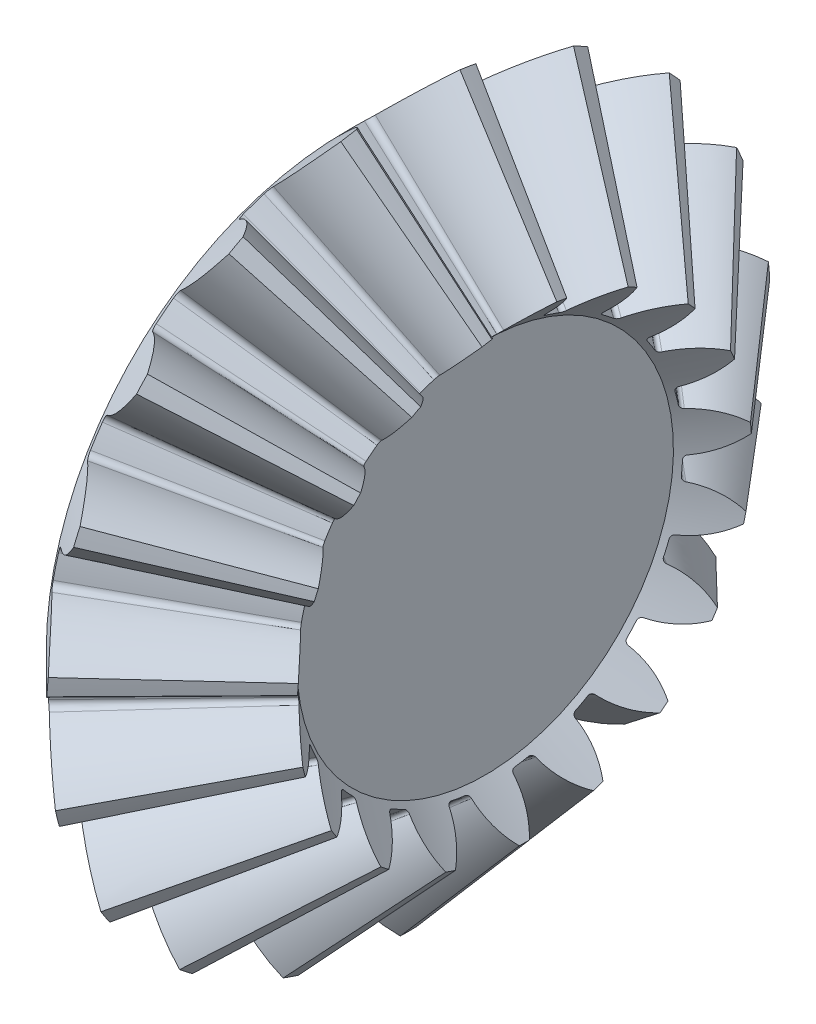
from build123d import *

# Parameters (mm, degrees)
TEETHCUTS_COUNT    = 19
TEETHCUTS_ANGLE    = 341.052631579
CUT_EXTRUDE1_DEPTH = 5.852975702


with BuildPart() as part:
    # BasProSke → Base-Revolve (revolve)
    with BuildSketch(Plane(origin=(0, 0, 0), x_dir=(1, 0, 0), z_dir=(0, 1, 0)), mode=Mode.PRIVATE) as base_revolve_sk:
        Polygon((0, 0), (0, 16.899008978), (3.515204589, 20.414213561), (10.059956604, 12.816829953), (7.852975702, 10.609849055), (7.852975702, 0), align=None)
    revolve(base_revolve_sk.sketch.rotate(Axis((-10, 0, 0), (1, 0, 0)), 180), axis=Axis((-10, 0, 0), (1, 0, 0)))

    # ToothCut: read off the stored shape, not the designer's step
    # ToothCut: loft between two sections, ruled curve by curve
    toothcut_from = [
        Edge.make_bspline([(21.106983915, 0.00599289, -0.009458337), (21.102776765, 0.001785739, -0.014789731), (21.097156118, -0.003834907, -0.013989325), (21.093785022, -0.007206003, -0.007578755)], [0, 0, 0, 0, 1, 1, 1, 1], 3, [1, 0.782762421, 0.782762421, 1]),
        Edge.make_bspline([(21.093785022, -0.007206003, 0.007578755), (21.097156118, -0.003834907, 0.013989325), (21.102776765, 0.001785739, 0.014789731), (21.106983915, 0.00599289, 0.009458337)], [0, 0, 0, 0, 1, 1, 1, 1], 3, [1, 0.782762421, 0.782762421, 1]),
        Edge.make_bspline([(21.093785022, -0.007206003, -0.007578755), (21.093275499, -0.007715527, -0.006609831), (21.092868168, -0.008122857, -0.005548601), (21.092571247, -0.008419779, -0.004416471)], [0, 0, 0, 0, 1, 1, 1, 1], 3, [1, 0.993277042, 0.993277042, 1]),
        Edge.make_bspline([(21.092571247, -0.008419779, 0.004416471), (21.092868168, -0.008122857, 0.005548601), (21.093275499, -0.007715527, 0.006609831), (21.093785022, -0.007206003, 0.007578755)], [0, 0, 0, 0, 1, 1, 1, 1], 3, [1, 0.993277042, 0.993277042, 1]),
        Edge.make_bspline([(21.092571247, -0.008419779, -0.004416471), (21.091815809, -0.009175216, -0.001536072), (21.091815809, -0.009175216, 0.001536072), (21.092571247, -0.008419779, 0.004416471)], [0, 0, 0, 0, 1, 1, 1, 1], 3, [1, 0.958390627, 0.958390627, 1]),
        Edge.make_line((21.106983915, 0.00599289, 0.009458337), (21.106983915, 0.00599289, -0.009458337)),
    ]
    toothcut_to = [
        Edge.make_bspline([(3.638619532, 20.537628503, -3.233490981), (2.826895847, 19.72590482, -2.04083435), (1.790509199, 18.689518174, -1.271402121), (0.635384071, 17.534393049, -1.00383455)], [0, 0, 0, 0, 1, 1, 1, 1], 3, [1, 0.965931478, 0.965931478, 1]),
        Edge.make_bspline([(0.635384071, 17.534393049, 1.00383455), (1.790509199, 18.689518174, 1.271402121), (2.826895847, 19.72590482, 2.04083435), (3.638619532, 20.537628503, 3.233490981)], [0, 0, 0, 0, 1, 1, 1, 1], 3, [1, 0.965931478, 0.965931478, 1]),
        Edge.make_bspline([(0.635384071, 17.534393049, -1.00383455), (0.496160966, 17.395169944, -0.971585586), (0.406834975, 17.305843953, -0.81715801), (0.41207804, 17.311087018, -0.617781075)], [0, 0, 0, 0, 1, 1, 1, 1], 3, [1, 0.833299949, 0.833299949, 1]),
        Edge.make_bspline([(0.41207804, 17.311087018, 0.617781075), (0.406834975, 17.305843953, 0.81715801), (0.496160966, 17.395169944, 0.971585586), (0.635384071, 17.534393049, 1.00383455)], [0, 0, 0, 0, 1, 1, 1, 1], 3, [1, 0.833299949, 0.833299949, 1]),
        Edge.make_bspline([(0.41207804, 17.311087018, -0.617781075), (0.422906174, 17.321915151, -0.206021909), (0.422906174, 17.321915151, 0.206021909), (0.41207804, 17.311087018, 0.617781075)], [0, 0, 0, 0, 1, 1, 1, 1], 3, [1, 0.999539447, 0.999539447, 1]),
        Edge.make_line((3.638619532, 20.537628503, 3.233490981), (3.638619532, 20.537628503, -3.233490981)),
    ]
    toothcut = Solid(Shell([*[Face.make_surface_from_curves(toothcut_from[k], toothcut_to[k]) for k in range(6)], Face(Wire(toothcut_from)), Face(Wire(toothcut_to))]))
    add(toothcut, mode=Mode.SUBTRACT)

    # TeethCuts: ToothCut ×19 about axis
    teethcuts_axis = Axis((-10, 0, 0), (1, 0, 0))
    for i in range(1, TEETHCUTS_COUNT):
        add(toothcut.rotate(teethcuts_axis, i * TEETHCUTS_ANGLE / (TEETHCUTS_COUNT - 1)), mode=Mode.SUBTRACT)

    # Sketch1 → Cut-Extrude1 (cut)
    with BuildSketch(Plane.ZY):
        with BuildLine():
            Line((1.6035, 2.046652816), (-1.6035, 2.046652816))
            ThreePointArc((-1.6035, 2.046652816), (0, -2.6), (1.6035, 2.046652816))
        make_face()
    extrude(amount=-CUT_EXTRUDE1_DEPTH, mode=Mode.SUBTRACT)


solid = part.part
